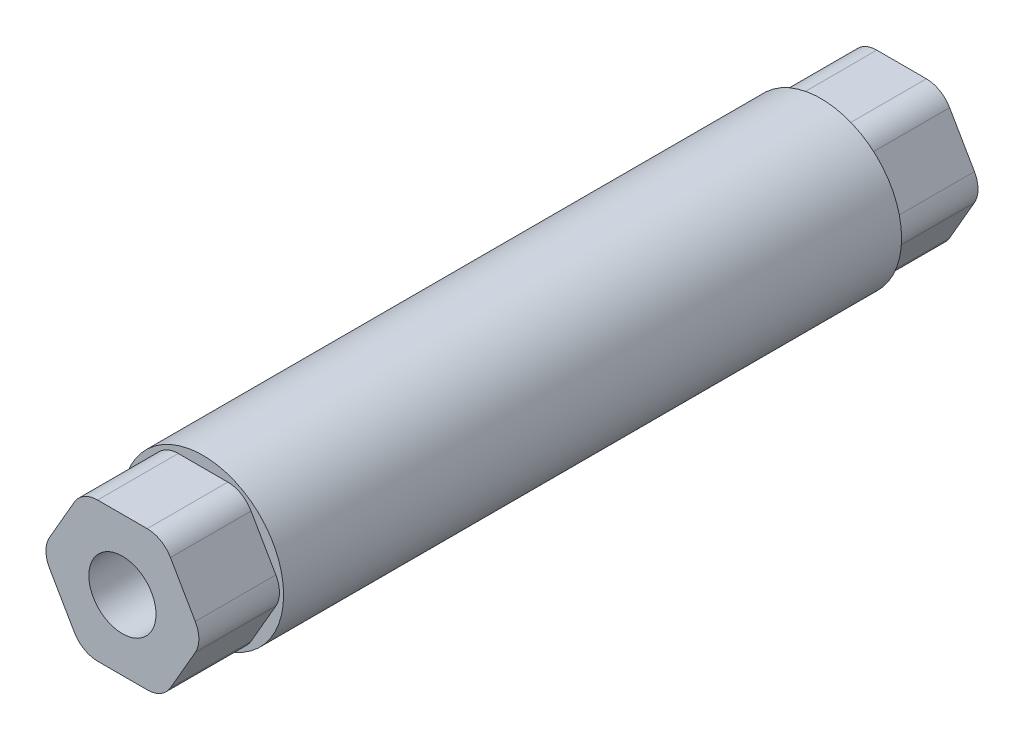
from build123d import *

# Parameters (mm, degrees)
SKETCH1_R           = 3
BOSS_EXTRUDE1_DEPTH = 29
CUT_EXTRUDE1_START  = -3
CUT_EXTRUDE1_DEPTH  = 3
FILLET1_R           = 1


with BuildPart() as part:
    # Sketch1 → Boss-Extrude1 (new body)
    with BuildSketch(Plane.XY):
        with Locations(Location((0, 0, 0), (0, 0, 180))):
            Circle(SKETCH1_R)
    extrude(amount=BOSS_EXTRUDE1_DEPTH)

    # Sketch3 → Cut-Extrude1 (cut)
    with BuildSketch(Plane.XY.offset(29).offset(CUT_EXTRUDE1_START)):
        with BuildLine():
            Line((-3, 0), (-1.5, 2.598076211))
            ThreePointArc((-1.5, 2.598076211), (-2.598076211, 1.5), (-3, 0))
        make_face()
        with BuildLine():
            Line((1.5, 2.598076211), (3, 0))
            ThreePointArc((3, 0), (2.598076211, 1.5), (1.5, 2.598076211))
        make_face()
        with BuildLine():
            Line((-1.5, 2.598076211), (1.5, 2.598076211))
            ThreePointArc((1.5, 2.598076211), (0, 3), (-1.5, 2.598076211))
        make_face()
        with BuildLine():
            ThreePointArc((-3, 0), (-2.598076211, -1.5), (-1.5, -2.598076211))
            Line((-1.5, -2.598076211), (-3, 0))
        make_face()
        with BuildLine():
            ThreePointArc((-1.5, -2.598076211), (0, -3), (1.5, -2.598076211))
            Line((1.5, -2.598076211), (-1.5, -2.598076211))
        make_face()
        with BuildLine():
            ThreePointArc((1.5, -2.598076211), (2.598076211, -1.5), (3, 0))
            Line((3, 0), (1.5, -2.598076211))
        make_face()
    cut_extrude1 = extrude(amount=CUT_EXTRUDE1_DEPTH, mode=Mode.SUBTRACT)

    # Mirror1: Cut-Extrude1 across plane
    add(cut_extrude1.mirror(Plane(origin=(0, 0, 14.5), x_dir=(1, 0, 0), z_dir=(0, 0, -1))), mode=Mode.SUBTRACT)

    # Sketch6 → Tap Drill for M3x0.5 Tap1 (revolve, cut)
    with BuildSketch(Plane(origin=(0, 0, 29), x_dir=(0, -1, 0), z_dir=(1, 0, 0))):
        Polygon((0, 0), (0, 5.751075774), (1.25, 5), (1.25, 0), align=None)
    tap_drill_for_m3x0_5_tap1 = revolve(axis=Axis((0, 0, 35.35), (0, 0, -1)), mode=Mode.SUBTRACT)

    # Mirror2: Tap Drill for M3x0.5 Tap1 across plane
    add(tap_drill_for_m3x0_5_tap1.mirror(Plane(origin=(0, 0, 14.5), x_dir=(1, 0, 0), z_dir=(0, 0, -1))), mode=Mode.SUBTRACT)

    # Fillet1
    # the kernel refuses this fillet: 1 mm, written as the material it takes off along each edge
    with BuildSketch(Plane(origin=(-1.5, 2.598076211, 26), x_dir=(-0.4999999999999951, -0.8660254037844416, 0), z_dir=(0, 0, 1)), Plane(origin=(3, 0, 26), x_dir=(-0.5000000000000018, 0.8660254037844377, 0), z_dir=(0, 0, 1)), Plane(origin=(1.5, 2.598076211, 26), x_dir=(-1, 0, 0), z_dir=(0, 0, 1)), Plane(origin=(1.5, -2.598076211, 26), x_dir=(0.4999999999999949, 0.8660254037844417, 0), z_dir=(0, 0, 1)), Plane(origin=(-1.5, -2.598076211, 26), x_dir=(1, 0, 0), z_dir=(0, 0, 1)), Plane(origin=(-3, 0, -1.443375673), x_dir=(0.500000000000007, -0.8660254037844346, 0), z_dir=(0, 0, 1)), Plane(origin=(3, 0, 3), x_dir=(-0.4999999999999955, -0.8660254037844413, 0), z_dir=(0, 0, -1)), Plane(origin=(1.5, -2.598076211, 3), x_dir=(-1, 0, 0), z_dir=(0, 0, -1)), Plane(origin=(-1.5, -2.598076211, 3), x_dir=(-0.5000000000000073, 0.8660254037844345, 0), z_dir=(0, 0, -1))) as fillet1_piece_1:
        with BuildLine():
            CenterArc((FILLET1_R * 0.57735026919, FILLET1_R), FILLET1_R, 210, 60)
            Line((-FILLET1_R * 0.288675134595, FILLET1_R * 0.5), (0, 0))
            Line((0, 0), (FILLET1_R * 0.57735026919, 0))
        make_face()
    extrude(amount=4.443375673, mode=Mode.SUBTRACT)
    with BuildSketch(Plane(origin=(-3, 0, 26), x_dir=(0.5000000000000109, 0.8660254037844323, 0), z_dir=(0, 0, 1)), Plane(origin=(-1.5, 2.598076211, 3), x_dir=(-0.4999999999999951, -0.8660254037844416, 0), z_dir=(0, 0, -1)), Plane(origin=(1.5, 2.598076211, 3), x_dir=(-1, 0, 0), z_dir=(0, 0, -1))) as fillet1_piece_2:
        with BuildLine():
            CenterArc((FILLET1_R * 0.57735026919, -FILLET1_R), FILLET1_R, 90, 60)
            Line((-FILLET1_R * 0.288675134595, -FILLET1_R * 0.5), (0, 0))
            Line((0, 0), (FILLET1_R * 0.57735026919, 0))
        make_face()
    extrude(amount=4.443375673, mode=Mode.SUBTRACT)


solid = part.part
